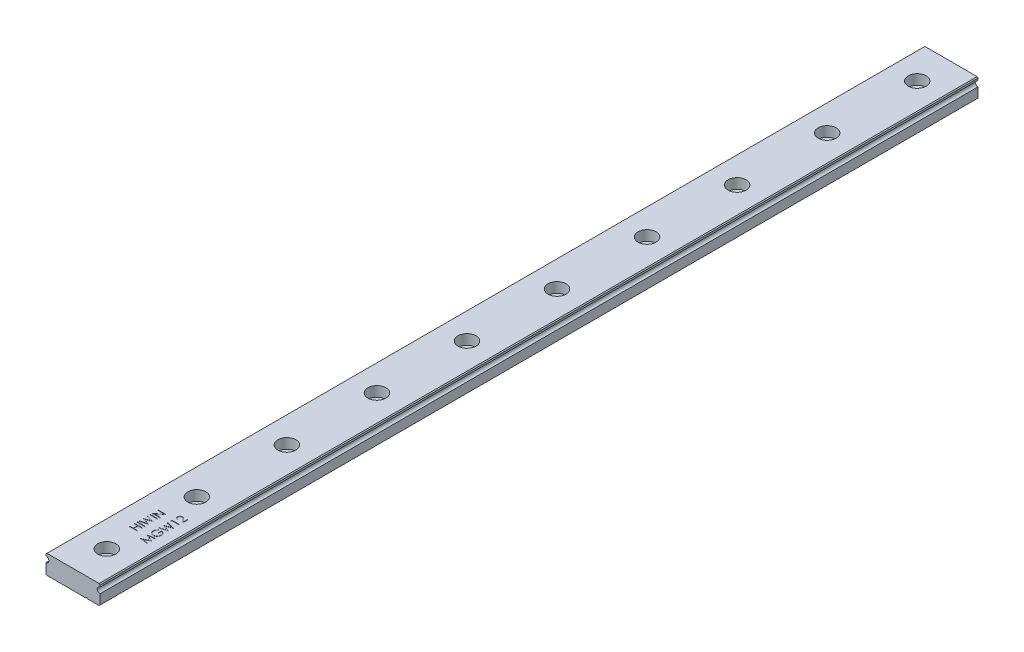
from build123d import *

# Parameters (mm, degrees)
EXTRUDE_1_DEPTH              = 390
HOLE_WIZARD_M4_1_D           = 4.5
HOLE_WIZARD_M4_1_CBORE_D     = 8
HOLE_WIZARD_M4_1_CBORE_DEPTH = 4.5
PATTERN_LINEAR_1_COUNT       = 10
PATTERN_LINEAR_1_PITCH       = 40
SKETCH_4_W                   = 3.5
SKETCH_4_H                   = 0.314102564
CUT_EXTRUDE_1_DEPTH          = 0.1


with BuildPart() as part:
    # 草图1 → 凸台-拉伸1 (new body)
    with BuildSketch(Plane.XY):
        with BuildLine():
            Line((-11.6, 8.5), (-12, 8.1))
            Line((-12, 8.1), (-12, 7.25))
            ThreePointArc((-12, 7.25), (-10.75, 6), (-12, 4.75))
            Line((-12, 4.75), (-12, 0.4))
            Line((-12, 0.4), (-11.6, 0))
            Line((-11.6, 0), (5.7, 0))
            ThreePointArc((5.7, 0), (6, 0.3), (6.3, 0))
            Line((6.3, 0), (11.6, 0))
            Line((11.6, 0), (12, 0.4))
            Line((12, 0.4), (12, 4.75))
            ThreePointArc((12, 4.75), (10.75, 6), (12, 7.25))
            Line((12, 7.25), (12, 8.1))
            Line((12, 8.1), (11.6, 8.5))
            Line((11.6, 8.5), (-11.6, 8.5))
        make_face()
    extrude(amount=-EXTRUDE_1_DEPTH)

    # M4 六角凹头螺钉的柱形沉头孔1 (through all)
    with Locations(Plane(origin=(-2.175360886, 8.5, -52.975227927), x_dir=(-1, 0, 0), z_dir=(0, 1, 0))):
        with Locations((-2.175360886, 37.975227927)):
            hole_wizard_m4_1 = CounterBoreHole(HOLE_WIZARD_M4_1_D / 2, HOLE_WIZARD_M4_1_CBORE_D / 2, HOLE_WIZARD_M4_1_CBORE_DEPTH)

    # 阵列(线性)1: M4 六角凹头螺钉的柱形沉头孔1 ×10
    with Locations(*[(0, 0, -i * PATTERN_LINEAR_1_PITCH) for i in range(1, PATTERN_LINEAR_1_COUNT)]):
        add(hole_wizard_m4_1, mode=Mode.SUBTRACT)

    # 草图4 → 切除-拉伸1 (cut)
    with BuildSketch(Plane(origin=(0, 8.5, 0), x_dir=(1, 0, 0), z_dir=(0, 1, 0))):
        Polygon((-3.5, 28.538461538), (-3.5, 28.852564103), (-2.064102564, 28.852564103), (-2.064102564, 30.647435897), (-3.5, 30.647435897), (-3.5, 30.961538462), (0, 30.961538462), (0, 30.647435897), (-1.705128205, 30.647435897), (-1.705128205, 28.852564103), (0, 28.852564103), (0, 28.538461538), align=None)
        with Locations((-1.75, 32.016025641)):
            Rectangle(SKETCH_4_W, SKETCH_4_H)
        Polygon((-3.5, 32.711538462), (-3.5, 33.036157853), (-0.933193109, 33.721153846), (-3.5, 34.739883814), (-3.5, 34.785456731), (-0.950721154, 35.78525641), (-3.5, 36.473758013), (-3.5, 36.794871795), (0, 35.851161859), (0, 35.806290064), (-2.676883013, 34.753205128), (0, 33.6875), (0, 33.642628205), align=None)
        with Locations((-1.75, 37.759615385)):
            Rectangle(SKETCH_4_W, SKETCH_4_H)
        Polygon((0, 38.679487179), (-3.5, 38.679487179), (-3.5, 38.745392628), (-0.745292468, 41.057692308), (-3.5, 41.057692308), (-3.5, 41.371794872), (0, 41.371794872), (0, 41.300280449), (-2.748397436, 38.993589744), (0, 38.993589744), align=None)
        Polygon((6.967948718, 25.913461538), (3.467948718, 26.375500801), (3.467948718, 26.420372596), (6.33974359, 27.865384615), (3.467948718, 29.306891026), (3.467948718, 29.352463942), (6.967948718, 29.817307692), (6.967948718, 29.501802885), (4.449519231, 29.166666667), (6.967948718, 27.903245192), (6.967948718, 27.832431891), (4.443910256, 26.564102564), (6.967948718, 26.229667468), align=None)
        with BuildLine():
            Line((4.065304487, 33.810897436), (4.320512821, 33.541666667))
            add(Edge.make_bspline(
                [(4.320512821, 33.541666667), (4.274666598, 33.492957586), (4.184067383, 33.396700921), (4.066704644, 33.239500979), (3.965171715, 33.076145126), (3.883176125, 32.906369226), (3.818854464, 32.734625226), (3.7720985, 32.563866272), (3.742488341, 32.395197974), (3.738931922, 32.283033672), (3.737179487, 32.227764423)],
                knots=[0, 0, 0, 0, 1.089067066, 2.152164705, 3.18986567, 4.218445106, 5.218487318, 6.173592265, 7.100032889, 8, 8, 8, 8], degree=3))
            add(Edge.make_bspline(
                [(3.737179487, 32.227764423), (3.737593093, 32.193849723), (3.738419232, 32.126108283), (3.748963447, 32.025486339), (3.764128311, 31.925919701), (3.786070189, 31.827596327), (3.813879248, 31.730325039), (3.848664714, 31.634444152), (3.889219947, 31.53977478), (3.936082466, 31.447208761), (3.987562143, 31.357468028), (4.044611304, 31.272712031), (4.105397829, 31.19239557), (4.171457105, 31.118046363), (4.242141407, 31.049169849), (4.316177774, 30.984499148), (4.395021846, 30.92523957), (4.478349397, 30.87245393), (4.56422185, 30.824786336), (4.651910923, 30.783594136), (4.740602575, 30.747784182), (4.83096464, 30.720510221), (4.922065521, 30.697409347), (5.014382632, 30.681328111), (5.108157049, 30.672231794), (5.170954747, 30.670661303), (5.202524038, 30.669871795)],
                knots=[0, 0, 0, 0, 1.028150113, 2.053633673, 3.06513288, 4.081487945, 5.106702018, 6.131327874, 7.172780699, 8.228344599, 9.276313556, 10.308389736, 11.324843658, 12.329040066, 13.321460474, 14.316307835, 15.308626991, 16.309440696, 17.305625405, 18.28535951, 19.246194545, 20.203493668, 21.145557131, 22.095268976, 23.042464743, 24, 24, 24, 24], degree=3))
            add(Edge.make_bspline(
                [(5.202524038, 30.669871795), (5.2347947, 30.67062799), (5.299247902, 30.672138316), (5.395444304, 30.681791513), (5.490200886, 30.699746723), (5.583666689, 30.723558473), (5.676027725, 30.753831148), (5.767187608, 30.791023662), (5.857137476, 30.835329794), (5.944984394, 30.886501063), (6.030484526, 30.943010531), (6.111697005, 31.005161715), (6.187676723, 31.073059251), (6.259533466, 31.145458195), (6.326813744, 31.223018191), (6.388706596, 31.306491722), (6.446169075, 31.394710315), (6.498569911, 31.487713104), (6.545377278, 31.584517084), (6.587001488, 31.683773515), (6.621280742, 31.785801417), (6.649218868, 31.890064083), (6.672119159, 31.996437361), (6.686851641, 32.105461162), (6.697542472, 32.216333871), (6.698324142, 32.291072503), (6.698717949, 32.328725962)],
                knots=[0, 0, 0, 0, 0.935915162, 1.869274651, 2.799799983, 3.730201895, 4.664668062, 5.616159355, 6.583070886, 7.570012957, 8.562524459, 9.553461134, 10.53281078, 11.515274572, 12.509912756, 13.507571325, 14.526460018, 15.561318395, 16.601025881, 17.643204557, 18.680545676, 19.719612342, 20.772381578, 21.833430283, 22.908478249, 24, 24, 24, 24], degree=3))
            add(Edge.make_bspline(
                [(6.698717949, 32.328725962), (6.697769766, 32.374104494), (6.695907855, 32.463212614), (6.681401983, 32.594196434), (6.658775513, 32.720009052), (6.625536462, 32.84024089), (6.583464013, 32.955328285), (6.531435433, 33.064846773), (6.469998149, 33.169098767), (6.400396255, 33.267633027), (6.322847788, 33.358107048), (6.239913081, 33.440449127), (6.15051765, 33.511827749), (6.0559938, 33.574375066), (5.955437392, 33.62607231), (5.84940783, 33.668518188), (5.737839505, 33.701050644), (5.660747985, 33.714405733), (5.621794872, 33.721153846)],
                knots=[0, 0, 0, 0, 1.130199668, 2.219330667, 3.279027493, 4.311506524, 5.322739849, 6.327972234, 7.327472899, 8.33386792, 9.329086447, 10.29244429, 11.240784345, 12.174119183, 13.111530729, 14.052100829, 15.015757696, 16, 16, 16, 16], degree=3))
            Line((5.621794872, 33.721153846), (5.621794872, 32.554487179))
            Line((5.621794872, 32.554487179), (5.262820513, 32.554487179))
            Line((5.262820513, 32.554487179), (5.262820513, 34.03525641))
            add(Edge.make_bspline(
                [(5.262820513, 34.03525641), (5.329728002, 34.033550562), (5.460678043, 34.030211908), (5.651648314, 34.006792993), (5.832020008, 33.968976481), (6.001983079, 33.917316169), (6.161296672, 33.850440888), (6.310122538, 33.76906836), (6.447499219, 33.671896239), (6.574548223, 33.562385797), (6.687877435, 33.43948584), (6.787483373, 33.30651722), (6.871385988, 33.163260251), (6.93964665, 33.009850444), (6.992920645, 32.84679001), (7.030692222, 32.673701631), (7.053322185, 32.49082003), (7.056213565, 32.365483353), (7.057692308, 32.301382212)],
                knots=[0, 0, 0, 0, 1.140356446, 2.231883559, 3.274166699, 4.278491846, 5.25512956, 6.21435461, 7.1637429, 8.11826594, 9.068280886, 10.0076534, 10.945064095, 11.891975133, 12.864533718, 13.863980011, 14.907571808, 16, 16, 16, 16], degree=3))
            add(Edge.make_bspline(
                [(7.057692308, 32.301382212), (7.057123186, 32.261872076), (7.056000696, 32.183945355), (7.048023349, 32.068854427), (7.035742772, 31.956936807), (7.017197649, 31.848208798), (6.994482995, 31.742270456), (6.965396276, 31.639650871), (6.931727576, 31.539959129), (6.893431903, 31.443041143), (6.849060246, 31.349776596), (6.799750607, 31.259750079), (6.745757246, 31.172463954), (6.6861464, 31.088512789), (6.62136394, 31.007459167), (6.551280021, 30.929825723), (6.476108901, 30.855177845), (6.422729892, 30.808417382), (6.395833333, 30.784855769)],
                knots=[0, 0, 0, 0, 1.107784379, 2.184907829, 3.233506516, 4.263428166, 5.276301166, 6.270063455, 7.25232949, 8.225834625, 9.190232166, 10.146266622, 11.1027726, 12.066435141, 13.031522626, 14.010570082, 14.99756817, 16, 16, 16, 16], degree=3))
            add(Edge.make_bspline(
                [(6.395833333, 30.784855769), (6.35316268, 30.750669837), (6.268529663, 30.682865425), (6.132929719, 30.595587268), (5.992527859, 30.521185865), (5.84693323, 30.460818043), (5.696282017, 30.413679957), (5.540766726, 30.379873704), (5.380187096, 30.360066415), (5.271521831, 30.357212877), (5.216546474, 30.355769231)],
                knots=[0, 0, 0, 0, 1.023165419, 2.029347347, 3.013907458, 3.994755782, 4.975994455, 5.96558838, 6.970761222, 8, 8, 8, 8], degree=3))
            add(Edge.make_bspline(
                [(5.216546474, 30.355769231), (5.175380222, 30.356301469), (5.093570914, 30.35735918), (4.972113608, 30.370184698), (4.85281291, 30.38858611), (4.735766374, 30.415633186), (4.620895706, 30.449729372), (4.508148028, 30.492283153), (4.397455075, 30.541826931), (4.289585288, 30.599416648), (4.185945674, 30.663485385), (4.087043404, 30.733093041), (3.994481386, 30.808776726), (3.908045197, 30.890756821), (3.826453743, 30.977380751), (3.751411343, 31.070467052), (3.681743707, 31.168605388), (3.618789497, 31.272556528), (3.562221643, 31.380680159), (3.512633564, 31.492741245), (3.471649942, 31.608699063), (3.436876246, 31.72768662), (3.411161083, 31.850604099), (3.392512344, 31.976559642), (3.379751742, 32.106209752), (3.378725487, 32.193845782), (3.378205128, 32.23828125)],
                knots=[0, 0, 0, 0, 1.00895651, 2.005089799, 2.991467152, 3.967318338, 4.948153826, 5.927364234, 6.919980553, 7.91976625, 8.923240147, 9.905815003, 10.88314567, 11.851989312, 12.825009789, 13.798721852, 14.781296708, 15.773896486, 16.776076962, 17.771600213, 18.775744723, 19.78957137, 20.808953803, 21.851964491, 22.910847925, 24, 24, 24, 24], degree=3))
            add(Edge.make_bspline(
                [(3.378205128, 32.23828125), (3.37878462, 32.274519494), (3.379933684, 32.346375672), (3.387898332, 32.453301405), (3.400522213, 32.558574419), (3.417749, 32.662350809), (3.44121269, 32.764277175), (3.469290975, 32.864643881), (3.501982797, 32.963596417), (3.540971644, 33.060824666), (3.585225269, 33.156982382), (3.635038691, 33.252604223), (3.691263696, 33.347363469), (3.754067231, 33.44142445), (3.822370649, 33.535380308), (3.898127473, 33.62774495), (3.978350229, 33.720747895), (4.036032413, 33.780549709), (4.065304487, 33.810897436)],
                knots=[0, 0, 0, 0, 0.985871117, 1.954866573, 2.915460327, 3.869826059, 4.81536089, 5.759505086, 6.70452669, 7.649098992, 8.607881297, 9.583363685, 10.581137262, 11.603961102, 12.659522466, 13.73993555, 14.853081303, 16, 16, 16, 16], degree=3))
        make_face()
        Polygon((3.467948718, 34.528846154), (3.467948718, 34.853465545), (6.034755609, 35.538461538), (3.467948718, 36.557191506), (3.467948718, 36.602764423), (6.017227564, 37.602564103), (3.467948718, 38.291065705), (3.467948718, 38.612179487), (6.967948718, 37.668469551), (6.967948718, 37.623597756), (4.291065705, 36.570512821), (6.967948718, 35.504807692), (6.967948718, 35.459935897), align=None)
        Polygon((3.467948718, 39.849659455), (3.467948718, 40.496794872), (6.967948718, 40.496794872), (6.967948718, 40.182692308), (3.826923077, 40.182692308), (3.826923077, 39.644230769), align=None)
        with BuildLine():
            Line((4.544871795, 42.246794872), (4.544871795, 41.932692308))
            add(Edge.make_bspline(
                [(4.544871795, 41.932692308), (4.503200907, 41.934739461), (4.421360393, 41.938760015), (4.302036486, 41.957588304), (4.187981687, 41.984529181), (4.080111773, 42.022620635), (3.977472966, 42.069926913), (3.880472951, 42.12665694), (3.789481762, 42.193850791), (3.705342919, 42.270057525), (3.628155348, 42.352826164), (3.561500105, 42.442132103), (3.505182434, 42.535977131), (3.458101192, 42.63407653), (3.422761346, 42.737537093), (3.396539706, 42.845419951), (3.38076336, 42.958199088), (3.379067575, 43.03503911), (3.378205128, 43.07411859)],
                knots=[0, 0, 0, 0, 1.10065271, 2.161652631, 3.183658789, 4.190468796, 5.17591951, 6.163126047, 7.15150782, 8.156236427, 9.156009102, 10.134482811, 11.092018607, 12.041330605, 13.001268258, 13.972401359, 14.968799086, 16, 16, 16, 16], degree=3))
            add(Edge.make_bspline(
                [(3.378205128, 43.07411859), (3.379096294, 43.112499365), (3.380847402, 43.187916216), (3.396111574, 43.297940024), (3.419502558, 43.402929123), (3.454164311, 43.501693673), (3.497657228, 43.595247277), (3.55174637, 43.682431585), (3.613872419, 43.765354805), (3.68715314, 43.83994721), (3.765343855, 43.908469332), (3.848850881, 43.967531259), (3.935199717, 44.018395855), (4.025064873, 44.060026938), (4.118738995, 44.09158515), (4.215323995, 44.114966761), (4.31593453, 44.128332953), (4.384043045, 44.130373055), (4.418669872, 44.131410256)],
                knots=[0, 0, 0, 0, 1.111674182, 2.184400057, 3.212814286, 4.223731311, 5.211378316, 6.196328225, 7.191884489, 8.207283132, 9.220262353, 10.201199469, 11.166417575, 12.120932471, 13.06540007, 14.026332106, 14.996573967, 16, 16, 16, 16], degree=3))
            add(Edge.make_bspline(
                [(4.418669872, 44.131410256), (4.467417685, 44.129716967), (4.564057857, 44.126360103), (4.706073028, 44.097646116), (4.843665276, 44.052798121), (4.954406352, 43.998805549), (5.043631398, 43.944322395), (5.117131164, 43.895274268), (5.196249826, 43.837528777), (5.281307615, 43.771579273), (5.371190628, 43.696290012), (5.46773272, 43.613617), (5.569148761, 43.521425177), (5.63846241, 43.456776545), (5.674379006, 43.423277244)],
                knots=[0, 0, 0, 0, 1.184416499, 2.348048165, 3.509039915, 4.696071444, 5.333504901, 6.05069495, 6.844171097, 7.714965912, 8.667477798, 9.695072654, 10.805644396, 12, 12, 12, 12], degree=3))
            Line((5.674379006, 43.423277244), (6.608974359, 42.547576122))
            Line((6.608974359, 42.547576122), (6.608974359, 44.176282051))
            Line((6.608974359, 44.176282051), (6.967948718, 44.176282051))
            Line((6.967948718, 44.176282051), (6.967948718, 41.798076923))
            Line((6.967948718, 41.798076923), (5.51943109, 43.155448718))
            add(Edge.make_bspline(
                [(5.51943109, 43.155448718), (5.484932783, 43.188496605), (5.418668597, 43.251974832), (5.321925636, 43.341757409), (5.232176096, 43.422396397), (5.149589547, 43.49441379), (5.072957979, 43.556247295), (5.004763276, 43.611119527), (4.942008826, 43.655085118), (4.869268212, 43.702800514), (4.780455894, 43.749014495), (4.671922205, 43.788726851), (4.560194953, 43.8129417), (4.484692915, 43.815846535), (4.446714744, 43.817307692)],
                knots=[0, 0, 0, 0, 1.329631726, 2.553950428, 3.673215718, 4.687767853, 5.603093632, 6.413772471, 7.123043292, 7.734684054, 8.834405432, 9.900288307, 10.943827018, 12, 12, 12, 12], degree=3))
            add(Edge.make_bspline(
                [(4.446714744, 43.817307692), (4.422833345, 43.81667195), (4.375767695, 43.815419024), (4.306761936, 43.804361327), (4.240197122, 43.78765082), (4.175868503, 43.763705562), (4.114422851, 43.732098822), (4.055785371, 43.693625442), (3.999096405, 43.649235379), (3.945943107, 43.59788411), (3.897261902, 43.54147259), (3.854137816, 43.48187834), (3.818098706, 43.418828236), (3.788555208, 43.352588114), (3.765379827, 43.283342644), (3.749321248, 43.210957899), (3.739238764, 43.135633883), (3.737874592, 43.084200387), (3.737179487, 43.057992788)],
                knots=[0, 0, 0, 0, 0.991446411, 1.95395049, 2.89581595, 3.838931463, 4.798493298, 5.75982156, 6.748411868, 7.785213223, 8.824556874, 9.840280684, 10.836137867, 11.835679398, 12.848801643, 13.863922112, 14.911575587, 16, 16, 16, 16], degree=3))
            add(Edge.make_bspline(
                [(3.737179487, 43.057992788), (3.737866305, 43.030615086), (3.739215103, 42.976849798), (3.749431569, 42.898078008), (3.764919735, 42.822414268), (3.789518324, 42.750987548), (3.818582779, 42.682251149), (3.855506038, 42.617672483), (3.898411684, 42.556179348), (3.948162531, 42.498783185), (4.004061204, 42.446362222), (4.0656654, 42.399655901), (4.132531619, 42.35911482), (4.204385428, 42.323693702), (4.281942223, 42.294941348), (4.364909073, 42.272967252), (4.452930694, 42.25558067), (4.513715745, 42.249772112), (4.544871795, 42.246794872)],
                knots=[0, 0, 0, 0, 1.030878251, 2.024474673, 2.987898669, 3.934362936, 4.864849709, 5.795128259, 6.730474222, 7.685293701, 8.650606017, 9.611896181, 10.591709709, 11.591680886, 12.625074257, 13.701333388, 14.821793024, 16, 16, 16, 16], degree=3))
        make_face()
    extrude(amount=-CUT_EXTRUDE_1_DEPTH, mode=Mode.SUBTRACT)


solid = part.part
